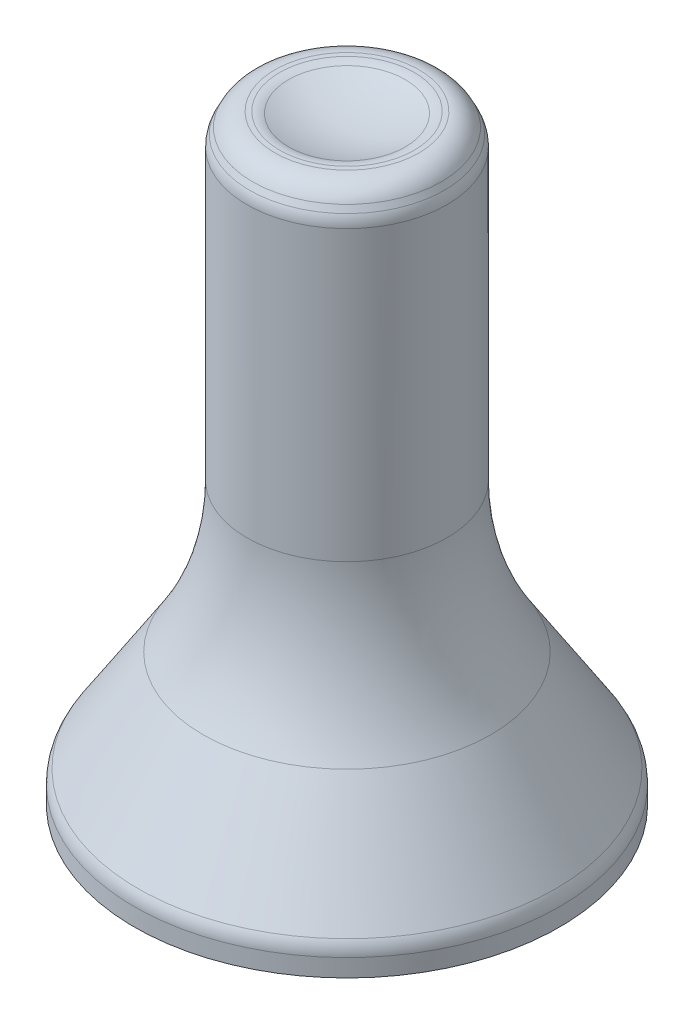
from build123d import *

# Parameters (mm, degrees)
FILLET1_R           = 11
FILLET2_R           = 1
BOSS_EXTRUDE1_DEPTH = 10.425
CHAMFER1_SIZE       = 0.35


with BuildPart() as part:
    # Sketch1 → Revolve1 (revolve)
    with BuildSketch(Plane.XY, mode=Mode.PRIVATE) as revolve1_sk:
        with BuildLine():
            Line((0, 0), (8.5, 0))
            Line((8.5, 0), (8.5, 1))
            Line((8.5, 1), (4, 8))
            Line((4, 8), (4, 23))
            Line((4, 23), (3.5, 24))
            Line((3.5, 24), (2.5, 24))
            add(Edge.make_bspline(
                [(2.5, 24), (1.3, 23.5), (0, 23.5)],
                knots=[0, 0, 0, 1, 1, 1], degree=2))
            Line((0, 23.5), (0, 0))
        make_face()
    revolve(revolve1_sk.sketch.rotate(Axis((0, 23.5, 0), (0, -1, 0)), 180), axis=Axis((0, 23.5, 0), (0, -1, 0)))

    # Fillet1
    fillet1_edges = [part.edges().sort_by_distance(p)[0] for p in [
        (4, 8, 0),
    ]]
    fillet(fillet1_edges, radius=FILLET1_R)

    # Fillet2
    fillet2_edges = [part.edges().sort_by_distance(p)[0] for p in [
        (2.5, 24, 0),
        (3.5, 24, 0),
        (4, 23, 0),
        (8.5, 1, 0),
    ]]
    fillet(fillet2_edges, radius=FILLET2_R)

    # Sketch3 → Cut-Revolve1 (revolve, cut)
    with BuildSketch(Plane.XY, mode=Mode.PRIVATE) as cut_revolve1_sk:
        Polygon((0, 0), (3.875, 0), (3.875, 6.5), (3.05, 7.325), (3.05, 17.75), (0, 17.75), align=None)
    revolve(cut_revolve1_sk.sketch.rotate(Axis((0, 17.75, 0), (0, -1, 0)), 180), axis=Axis((0, 17.75, 0), (0, -1, 0)), mode=Mode.SUBTRACT)

    # Sketch4 → Boss-Extrude1 (add)
    with BuildSketch(Plane.XZ.offset(-17.75)):
        with BuildLine():
            Line((-2.655654345, 1.5), (2.655654345, 1.5))
            ThreePointArc((2.655654345, 1.5), (0, 3.05), (-2.655654345, 1.5))
        make_face()
        with BuildLine():
            ThreePointArc((-0.099986562, -3.048360656), (0, -3.05), (0.099986562, -3.048360656))
            ThreePointArc((0.099986562, -3.048360656), (0, -2.95), (-0.099986562, -3.048360656))
        make_face()
    extrude(amount=BOSS_EXTRUDE1_DEPTH)

    # Chamfer1
    # the kernel refuses this chamfer: 0.35 mm, written as the material it takes off along each edge
    with BuildSketch(Plane(origin=(-3.555743391, 7.325, 1.5), x_dir=(0, -0.02749587661058614, 0.9996219169112968), z_dir=(1, 0, 0))) as chamfer1_piece_1_section:
        Polygon((CHAMFER1_SIZE * 0.999621916911, -CHAMFER1_SIZE * 0.0274958766106), (-CHAMFER1_SIZE * 0.0274958766106, -CHAMFER1_SIZE * 0.999621916911), (0, 0), align=None)
    chamfer1_piece_1 = extrude(amount=7.111486782, mode=Mode.PRIVATE)
    chamfer1_piece_1 = chamfer1_piece_1 & Plane(origin=(0, 7.499624527, 0), x_dir=(-1, 0, 0), z_dir=(0, 1, 0)) * Cylinder(3.05, 16, mode=Mode.PRIVATE)
    add(chamfer1_piece_1, mode=Mode.SUBTRACT)


solid = part.part
